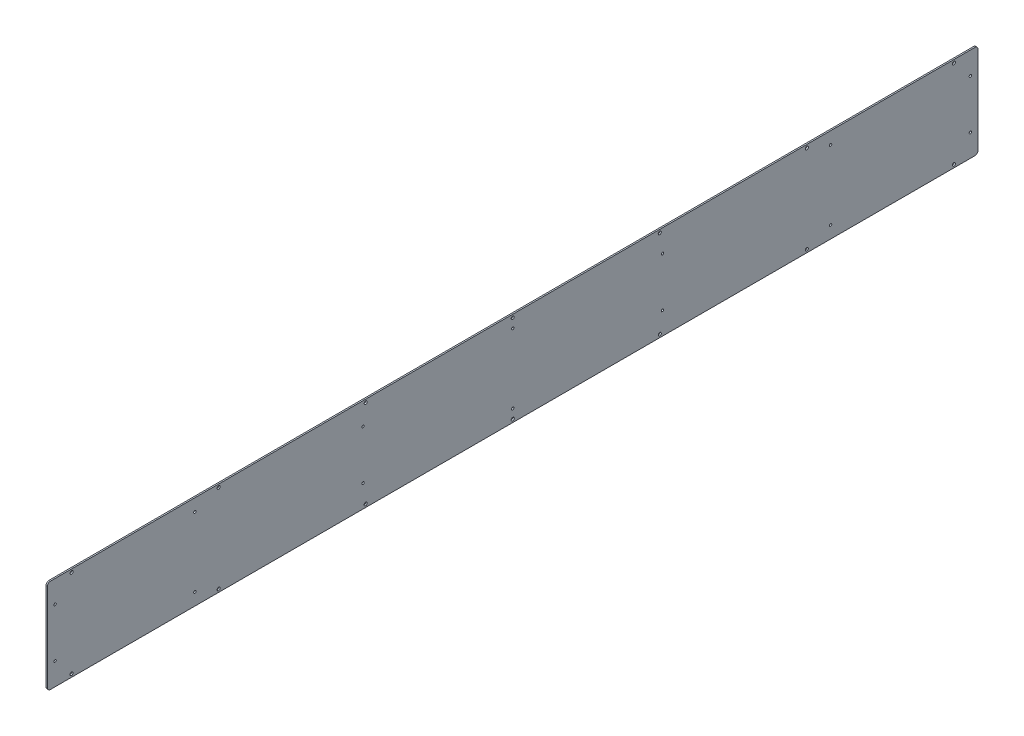
from build123d import *

# Parameters (mm, degrees)
SKETCH1_W                   = 1928.8125
SKETCH1_H                   = 194.564
BOSS_EXTRUDE1_DEPTH         = 2.9972
SKETCH2_R                   = 2.4511
CUT_EXTRUDE1_DEPTH          = 1939.603052061
FILLET1_R                   = 6.35
F_1_4_0_25_DIAMETER_HOLE1_D = 6.35


with BuildPart() as part:
    # Sketch1 → Boss-Extrude1 (new body)
    with BuildSketch(Plane(origin=(0, 0, 0), x_dir=(0, 0, -1), z_dir=(1, 0, 0))):
        with Locations((964.40625, 97.282)):
            Rectangle(SKETCH1_W, SKETCH1_H)
    extrude(amount=BOSS_EXTRUDE1_DEPTH)

    # Sketch2 → Cut-Extrude1 (cut, through all)
    with BuildSketch(Plane(origin=(2.9972, 0, 0), x_dir=(0, 0, -1), z_dir=(1, 0, 0))):
        with Locations((15.875, 148.082)):
            Circle(SKETCH2_R)
        with Locations((654.05, 148.082)):
            Circle(SKETCH2_R)
        with Locations((305.562, 169.164)):
            Circle(SKETCH2_R)
        with Locations((964.40625, 169.164)):
            Circle(SKETCH2_R)
        with Locations((964.40625, 25.4)):
            Circle(SKETCH2_R)
        with Locations((305.562, 25.4)):
            Circle(SKETCH2_R)
        with Locations((15.875, 46.482)):
            Circle(SKETCH2_R)
        with Locations((654.05, 46.482)):
            Circle(SKETCH2_R)
        with Locations((1623.2505, 25.4)):
            Circle(SKETCH2_R)
        with Locations((1623.2505, 169.164)):
            Circle(SKETCH2_R)
        with Locations((1912.9375, 46.482)):
            Circle(SKETCH2_R)
        with Locations((1912.9375, 148.082)):
            Circle(SKETCH2_R)
        with Locations((1274.7625, 46.482)):
            Circle(SKETCH2_R)
        with Locations((1274.7625, 148.082)):
            Circle(SKETCH2_R)
    extrude(amount=-CUT_EXTRUDE1_DEPTH, mode=Mode.SUBTRACT)

    # Fillet1
    fillet1_edges = [part.edges().sort_by_distance(p)[0] for p in [
        (1.4986, 0, -1928.8125),
        (1.4986, 194.564, -1928.8125),
        (1.4986, 0, 0),
        (1.4986, 194.564, 0),
    ]]
    fillet(fillet1_edges, radius=FILLET1_R)

    # 1/4 (0.25) Diameter Hole1 (through all)
    with Locations(Plane(origin=(2.9972, 0, 0), x_dir=(0, 0, -1), z_dir=(1, 0, 0))):
        with Locations((964.40625, 6.35), (659.60625, 6.35), (354.80625, 6.35), (50.00625, 6.35), (1269.20625, 6.35), (1574.00625, 6.35), (1878.80625, 6.35), (1878.80625, 188.214), (1574.00625, 188.214), (1269.20625, 188.214), (50.00625, 188.214), (354.80625, 188.214), (659.60625, 188.214), (964.40625, 188.214)):
            Hole(F_1_4_0_25_DIAMETER_HOLE1_D / 2)


solid = part.part
